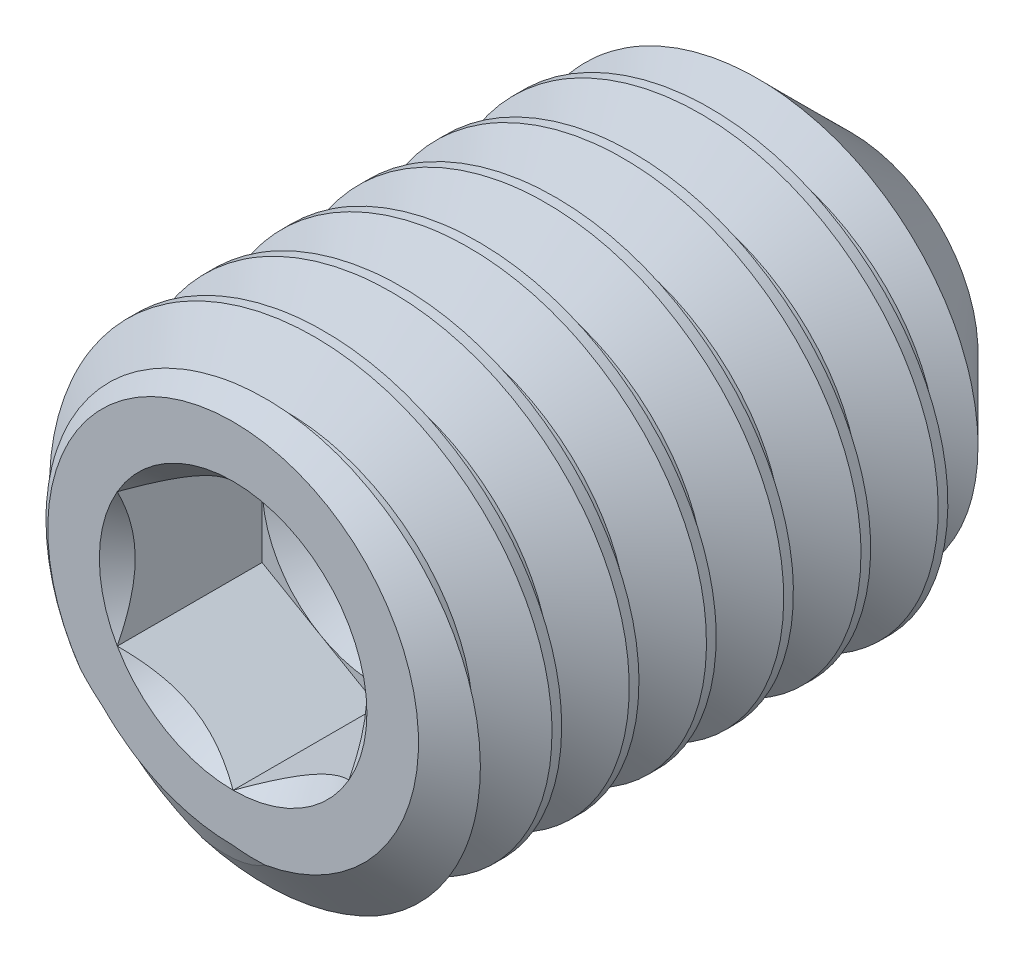
from build123d import *

# Parameters (mm, degrees)
CUT_SWEEP2_PITCH    = 0.5
CUT_EXTRUDE10_DEPTH = 0.9375


with BuildPart() as part:
    # Sketch22 → Revolve1 (revolve)
    with BuildSketch(Plane(origin=(0, 0, 0), x_dir=(0, 0, -1), z_dir=(1, 0, 0)), mode=Mode.PRIVATE) as revolve1_sk:
        Polygon((-1.7530621, 0), (-1.7530621, 1.2), (-1.542999839, 1.5), (1.568885259, 1.5), (2.2469379, 0.821947359), (1.7530621, 0), align=None)
    revolve(revolve1_sk.sketch.rotate(Axis((0, 0, -1.7530621), (0, 0, -1)), 180), axis=Axis((0, 0, -1.7530621), (0, 0, -1)))

    # Cut-Sweep2: arcs per turn and ends read off the stored shape
    # Cut-Sweep2: the profile of Sketch28 profile screwed along a right-hand helix through 9 turns, 6 arcs to a turn; built about Z, then put on its axis
    cut_sweep2_z = Axis((0, 0, 0), (0, 0, 1))
    cut_sweep2_corners = [(1.5003, -2.62e-07, -0.124826809), (1.5003, -2.62e-07, -0.562673219), (1.175240474, -2.05e-07, -0.375000014), (1.175240474, -2.05e-07, -0.312500014)]
    with BuildLine(mode=Mode.PRIVATE) as cut_sweep2_profile:
        Line(cut_sweep2_corners[0], cut_sweep2_corners[1])
        Line(cut_sweep2_corners[1], cut_sweep2_corners[2])
        Line(cut_sweep2_corners[2], cut_sweep2_corners[3])
        Line(cut_sweep2_corners[3], cut_sweep2_corners[0])
    cut_sweep2_cap = Face(cut_sweep2_profile.wire())
    cut_sweep2_turn_angles = [0, 30, 60, 90, 120, 150, 180, 210, 240, 270, 300, 330, 360]
    cut_sweep2_turn_weights = [1, 0.8660254037844387, 1, 0.8660254037844387, 1, 0.8660254037844387, 1, 0.8660254037844387, 1, 0.8660254037844387, 1, 0.8660254037844387, 1]
    cut_sweep2_turn_rails = [Edge.make_bspline([Vector(p[0], p[1], 0).rotate(cut_sweep2_z, cut_sweep2_turn_angles[k]) / cut_sweep2_turn_weights[k] + Vector(0, 0, p[2] + CUT_SWEEP2_PITCH * cut_sweep2_turn_angles[k] / 360) for k in range(13)], [0, 0, 0, 1, 1, 2, 2, 3, 3, 4, 4, 5, 5, 6, 6, 6], 2, cut_sweep2_turn_weights) for p in cut_sweep2_corners]
    cut_sweep2_turn_sides = [Face.make_surface_from_curves(cut_sweep2_turn_rails[p[0]], cut_sweep2_turn_rails[p[1]]) for p in [(0, 1), (1, 2), (2, 3), (3, 0)]]
    cut_sweep2 = Plane(origin=(0, 0, -2.2469379), x_dir=(1, 0, 0), z_dir=(0, 0, 1)) * Solid(Shell([*[p.moved(Location((0, 0, CUT_SWEEP2_PITCH * i))) for i in range(9) for p in cut_sweep2_turn_sides], cut_sweep2_cap, cut_sweep2_cap.rotate(cut_sweep2_z, 3240).moved(Location((0, 0, CUT_SWEEP2_PITCH * 3240 / 360)))]))
    add(cut_sweep2, mode=Mode.SUBTRACT)

    # Sketch23 → Cut-Extrude10 (cut)
    with BuildSketch(Plane.XY.offset(1.7530621)):
        Polygon((0, 0.866025404), (-0.75, 0.433012702), (-0.75, -0.433012702), (0, -0.866025404), (0.75, -0.433012702), (0.75, 0.433012702), align=None)
    extrude(amount=-CUT_EXTRUDE10_DEPTH, mode=Mode.SUBTRACT)

    # Cut-Extrude11 cone 1 section (through the dimple's axis) → Cut-Extrude11 (revolve, cut)
    with BuildSketch(Plane(origin=(0, 0, 1.7530621), x_dir=(0, -1, 0), z_dir=(1, 0, 0))):
        Polygon((0, 0), (0.866025404, 0), (0, 0.866025404), align=None)
    revolve(axis=Axis((0, 0, 1.7530621), (0, 0, -1)), mode=Mode.SUBTRACT)

    # Cut-Extrude12 cone 1 section (through the dimple's axis) → Cut-Extrude12 (revolve, cut)
    with BuildSketch(Plane(origin=(0, 0, 0.8155621), x_dir=(0, -1, 0), z_dir=(1, 0, 0))):
        Polygon((0, 0), (0.75, 0), (0, 0.433012702), align=None)
    revolve(axis=Axis((0, 0, 0.8155621), (0, 0, -1)), mode=Mode.SUBTRACT)


solid = part.part
